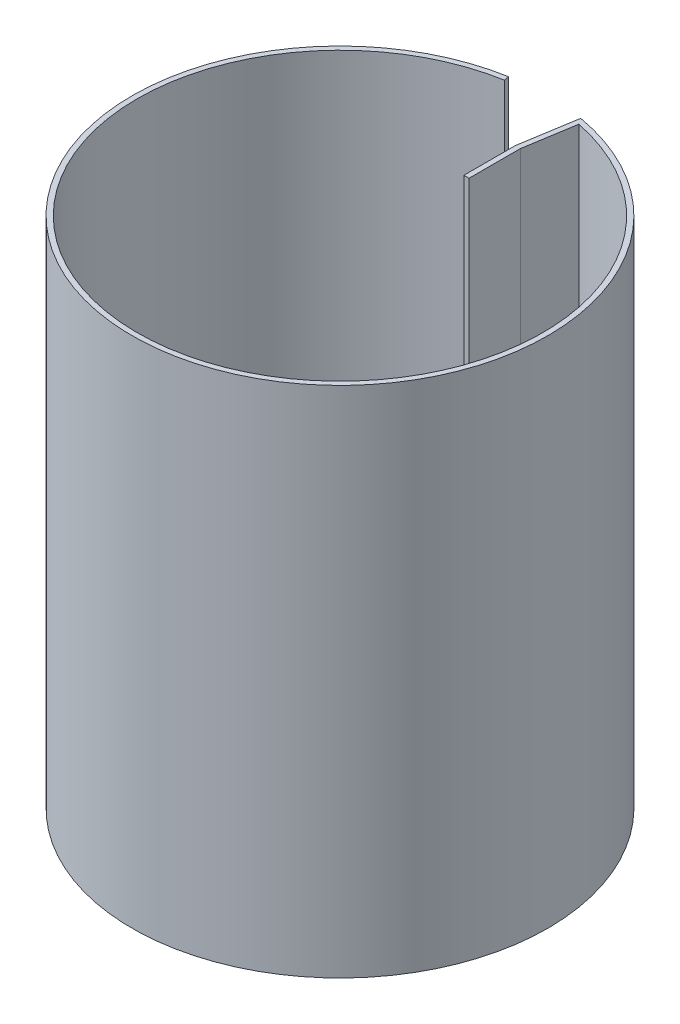
from build123d import *

# Parameters (mm, degrees)
RESSALTO_EXTRUS_O1_DEPTH = 200


with BuildPart() as part:
    # Esboço1 → Ressalto-extrusão1 (new body)
    with BuildSketch(Plane(origin=(0, 0, 0), x_dir=(1, 0, 0), z_dir=(0, 1, 0))):
        with BuildLine():
            Line((-13.718206036, 77.799812488), (-14.065502391, 79.769427994))
            ThreePointArc((-14.065502391, 79.769427994), (0, -81), (14.065502391, 79.769427994))
            Line((14.065502391, 79.769427994), (13.718206036, 77.799812488))
            Line((13.718206036, 77.799812488), (10.5, 57.8))
            Line((10.5, 57.8), (10.5, 37.8))
            Line((10.5, 37.8), (12.5, 37.8))
            Line((12.5, 37.8), (12.5, 57.8))
            Line((12.5, 57.8), (15.659101617, 77.432503101))
            ThreePointArc((15.659101617, 77.432503101), (-0.987673003, -78.993825721), (-13.718206036, 77.799812488))
        make_face()
    extrude(amount=RESSALTO_EXTRUS_O1_DEPTH)


solid = part.part
